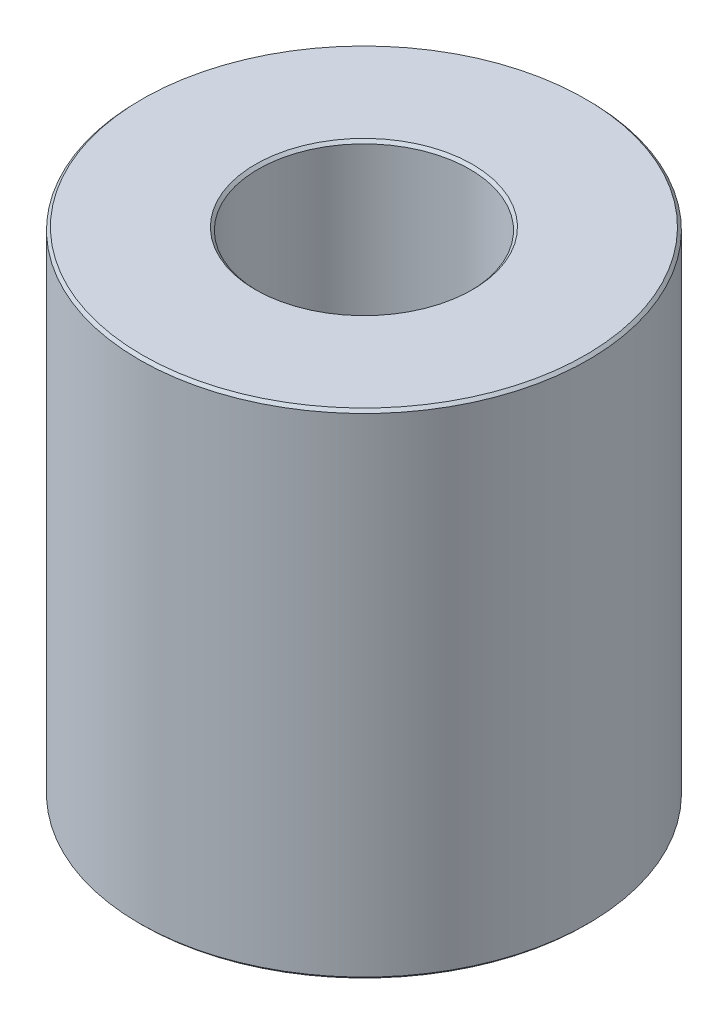
from build123d import *

# Parameters (mm, degrees)
SKETCH1_R           = 25
BOSS_EXTRUDE1_DEPTH = 54.973955403
SKETCH2_R           = 11.783636318
CUT_EXTRUDE1_DEPTH  = 66.361577189
CHAMFER1_SIZE       = 0.309520692


with BuildPart() as part:
    # Sketch1 → Boss-Extrude1 (new body)
    with BuildSketch(Plane(origin=(0, 0, 0), x_dir=(1, 0, 0), z_dir=(0, 1, 0))):
        Circle(SKETCH1_R)
    extrude(amount=BOSS_EXTRUDE1_DEPTH)

    # Sketch2 → Cut-Extrude1 (cut, through all)
    with BuildSketch(Plane(origin=(0, 0, 0), x_dir=(1, 0, 0), z_dir=(0, 1, 0))):
        Circle(SKETCH2_R)
    extrude(amount=CUT_EXTRUDE1_DEPTH, mode=Mode.SUBTRACT)

    # Chamfer1
    chamfer1_edges = [part.edges().sort_by_distance(p)[0] for p in [
        (-11.783636318, 54.973955403, 0),
        (-11.783636318, 0, 0),
        (-25, 0, 0),
        (-25, 54.973955403, 0),
    ]]
    chamfer(chamfer1_edges, length=CHAMFER1_SIZE)


solid = part.part
